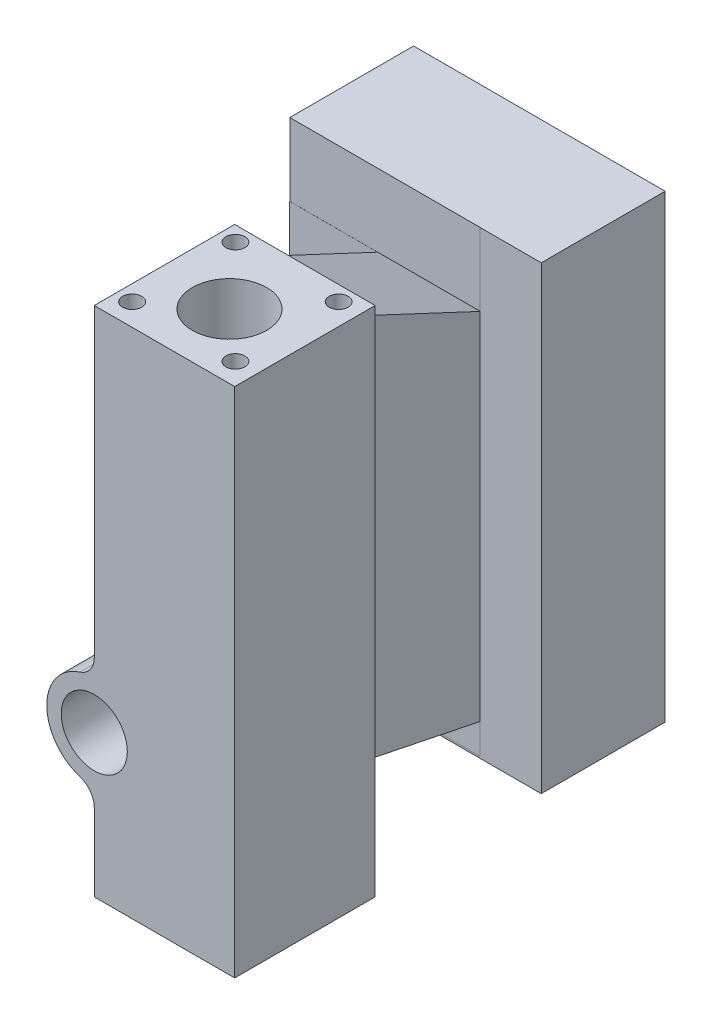
from build123d import *

# Parameters (mm, degrees)
SKETCH1_W            = 34
SKETCH1_H            = 124
BOSS_EXTRUDE1_DEPTH  = 34
SKETCH2_R            = 11.504012884
BOSS_EXTRUDE2_DEPTH  = 34
FILLET1_R            = 5
SKETCH3_R            = 13.586232418
CUT_EXTRUDE1_DEPTH   = 50
SKETCH4_R            = 8
CUT_EXTRUDE2_DEPTH   = 20
SKETCH5_W            = 24.830906905
SKETCH5_H            = 111.203932215
BOSS_EXTRUDE3_DEPTH  = 30
SKETCH6_W            = 60.899939779
SKETCH6_H            = 111.310961987
BOSS_EXTRUDE4_DEPTH  = 30
SKETCH7_R            = 8.998724885
CUT_EXTRUDE3_DEPTH   = 100
CUT_EXTRUDE5_DEPTH   = 100
SKETCH10_R           = 8.086489114
CUT_EXTRUDE6_DEPTH   = 10
SKETCH11_R           = 2.301516645
CUT_EXTRUDE7_DEPTH   = 10
LPATTERN1_COUNT      = 2
LPATTERN1_PITCH      = 25
LPATTERN1_COUNT_DIR2 = 2
LPATTERN1_PITCH_DIR2 = 25


with BuildPart() as part:
    # Sketch1 → Boss-Extrude1 (new body)
    with BuildSketch(Plane.XY):
        with Locations((-5.18125, -12.690625)):
            Rectangle(SKETCH1_W, SKETCH1_H)
    extrude(amount=BOSS_EXTRUDE1_DEPTH)

    # Sketch2 → Boss-Extrude2 (add)
    with BuildSketch(Plane.XY.offset(34)):
        with Locations((-22.18125, -40.250791069)):
            Circle(SKETCH2_R)
    extrude(amount=-BOSS_EXTRUDE2_DEPTH)

    # Fillet1
    fillet1_edges = [part.edges().sort_by_distance(p)[0] for p in [
        (-22.18125, -51.754803953, 17),
        (-22.18125, -28.746778185, 17),
    ]]
    fillet(fillet1_edges, radius=FILLET1_R)

    # Sketch3 → Cut-Extrude1 (cut)
    with BuildSketch(Plane.XZ.offset(74.690625)):
        with Locations((-4.893604294, 17.106225038)):
            Circle(SKETCH3_R)
    extrude(amount=-CUT_EXTRUDE1_DEPTH, mode=Mode.SUBTRACT)

    # Sketch4 → Cut-Extrude2 (cut)
    with BuildSketch(Plane.XY.offset(34)):
        with Locations((-22.18125, -40.250791069)):
            Circle(SKETCH4_R)
    extrude(amount=-CUT_EXTRUDE2_DEPTH, mode=Mode.SUBTRACT)

    # Sketch5 → Boss-Extrude3 (add)
    with BuildSketch(Plane(origin=(0, 0, 0), x_dir=(-1, 0, 0), z_dir=(0, 0, -1))):
        with Locations((5.153648801, -6.911017359)):
            Rectangle(SKETCH5_W, SKETCH5_H)
    extrude(amount=BOSS_EXTRUDE3_DEPTH)

    # Sketch6 → Boss-Extrude4 (add)
    with BuildSketch(Plane(origin=(0, 0, -30), x_dir=(-1, 0, 0), z_dir=(0, 0, -1))):
        with Locations((8.418056821, -7.285621558)):
            Rectangle(SKETCH6_W, SKETCH6_H)
    extrude(amount=BOSS_EXTRUDE4_DEPTH)

    # Sketch7 → Cut-Extrude3 (cut)
    with BuildSketch(Plane(origin=(0, 49.309375, 0), x_dir=(1, 0, 0), z_dir=(0, 1, 0))):
        with Locations((-5.091502482, -18.358859801)):
            Circle(SKETCH7_R)
    extrude(amount=-CUT_EXTRUDE3_DEPTH, mode=Mode.SUBTRACT)

    # Sketch9 → Cut-Extrude5 (cut)
    with BuildSketch(Plane(origin=(7.261804652, 0, 0), x_dir=(0, 0, -1), z_dir=(1, 0, 0))):
        Polygon((-0.011900431, 53.158400833), (-0.011900431, 44.862473141), (30.018715365, 30.783528167), (30.018715365, 53.158400833), align=None)
        Polygon((-0.011900431, -49.028418821), (-0.011900431, -66.373805341), (29.994778619, -69.28142928), (29.994778619, -55.173209223), align=None)
    extrude(amount=-CUT_EXTRUDE5_DEPTH, mode=Mode.SUBTRACT)

    # Sketch10 → Cut-Extrude6 (cut)
    with BuildSketch(Plane.ZY.offset(38.86802671)):
        with Locations((-45, -22.941102551)):
            Circle(SKETCH10_R)
    extrude(amount=-CUT_EXTRUDE6_DEPTH, mode=Mode.SUBTRACT)

    # Sketch11 → Cut-Extrude7 (cut)
    with BuildSketch(Plane(origin=(0, 49.309375, 0), x_dir=(1, 0, 0), z_dir=(0, 1, 0))):
        with Locations((6.624715973, -28.639015413)):
            Circle(SKETCH11_R)
    cut_extrude7 = extrude(amount=-CUT_EXTRUDE7_DEPTH, mode=Mode.SUBTRACT)

    # LPattern1: Cut-Extrude7 2 × 2
    with Locations(*[(-i * LPATTERN1_PITCH, 0, -j * LPATTERN1_PITCH_DIR2) for i in range(LPATTERN1_COUNT) for j in range(LPATTERN1_COUNT_DIR2) if (i, j) != (0, 0)]):
        add(cut_extrude7, mode=Mode.SUBTRACT)


solid = part.part
